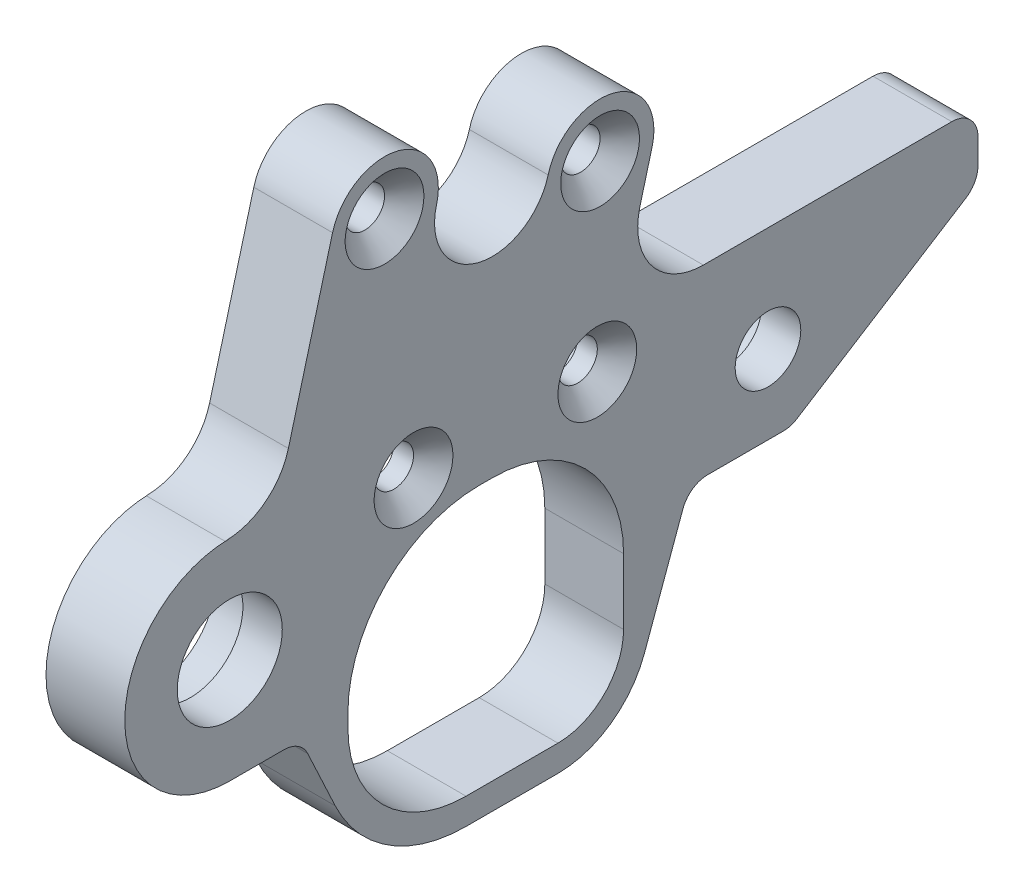
from build123d import *

# Parameters (mm, degrees)
SKETCH27_R          = 4
SKETCH27_R_2        = 2.5
SKETCH27_R_3        = 1.5
BOSS_EXTRUDE1_DEPTH = 6
SKETCH47_R          = 4.99
CUT_EXTRUDE8_DEPTH  = 3
SKETCH49_W          = 20
SKETCH49_H          = 6
CUT_EXTRUDE11_DEPTH = 3
CUT_EXTRUDE13_REACH = 97.747
SKETCH51_R          = 1.5
FILLET3_R           = 2
CHAMFER1_SIZE       = 1.5
FILLET5_START       = -1
FILLET5_DEPTH       = 4
SKETCH52_R          = 3
CUT_EXTRUDE14_DEPTH = 3
SKETCH53_R          = 1.5
CUT_EXTRUDE15_DEPTH = 3


with BuildPart() as part:
    # Sketch27 → Boss-Extrude1 (new body)
    with BuildSketch(Plane(origin=(0, 0, 0), x_dir=(0, 0, -1), z_dir=(1, 0, 0))):
        with BuildLine():
            Line((9, 50), (8.635545685, 50))
            ThreePointArc((8.635545685, 50), (11.67935283, 51.033233299), (13.465174817, 53.705904774))
            Line((13.465174817, 53.705904774), (16.829334589, 66.261119968))
            ThreePointArc((16.829334589, 66.261119968), (21.850788561, 69.160257771), (24.749926364, 64.138803798))
            ThreePointArc((24.749926364, 64.138803798), (27.861196202, 58.749926364), (33.250073636, 61.861196202))
            ThreePointArc((33.250073636, 61.861196202), (38.271527608, 64.760334004), (41.170665411, 59.738880032))
            Line((41.170665411, 59.738880032), (40.247638104, 56.294095226))
            ThreePointArc((40.247638104, 56.294095226), (41.110500534, 51.956192855), (45.077267236, 50))
            Line((45.077267236, 50), (66, 50))
            Line((66, 50), (66, 45))
            Line((66, 45), (51.734508099, 36))
            Line((51.734508099, 36), (43.997036047, 36))
            Line((43.997036047, 36), (40.577848346, 26.605858997))
            ThreePointArc((40.577848346, 26.605858997), (38.015035054, 23.26593569), (34, 22))
            Line((34, 22), (27, 22))
            ThreePointArc((27, 22), (21.089704308, 23.722694096), (17.030614343, 28.351199121))
            Line((17.030614343, 28.351199121), (14.396535233, 34))
            Line((14.396535233, 34), (9, 34))
            ThreePointArc((9, 34), (1, 42), (9, 50))
        make_face()
        with Locations((9, 42)):
            Circle(SKETCH27_R, mode=Mode.SUBTRACT)
        with Locations((50, 42)):
            Circle(SKETCH27_R_2, mode=Mode.SUBTRACT)
        with Locations((37.210369523, 60.800038117)):
            Circle(SKETCH27_R_3, mode=Mode.SUBTRACT)
        with Locations((20.789630477, 65.199961883)):
            Circle(SKETCH27_R_3, mode=Mode.SUBTRACT)
        with BuildLine():
            Line((29, 44), (28, 44))
            ThreePointArc((28, 44), (20.928932188, 41.071067812), (18, 34))
            Line((18, 34), (18, 33))
            ThreePointArc((18, 33), (20.636038969, 26.636038969), (27, 24))
            Line((27, 24), (34, 24))
            ThreePointArc((34, 24), (37.535533906, 25.464466094), (39, 29))
            Line((39, 29), (39, 34))
            ThreePointArc((39, 34), (36.071067812, 41.071067812), (29, 44))
        make_face(mode=Mode.SUBTRACT)
    extrude(amount=BOSS_EXTRUDE1_DEPTH)

    # Sketch47 → Cut-Extrude8 (cut)
    with BuildSketch(Plane.ZY):
        with Locations((-9, 42)):
            Circle(SKETCH47_R)
    extrude(amount=-CUT_EXTRUDE8_DEPTH, mode=Mode.SUBTRACT)

    # Sketch49 → Cut-Extrude11 (cut)
    with BuildSketch(Plane.ZY):
        with Locations((-30, 47)):
            Rectangle(SKETCH49_W, SKETCH49_H)
    extrude(amount=-CUT_EXTRUDE11_DEPTH, mode=Mode.SUBTRACT)

    # Sketch51 → Cut-Extrude13 (cut, up to next)
    with BuildSketch(Plane.ZY.offset(-3), mode=Mode.PRIVATE) as cut_extrude13_sk1:
        with Locations((-37, 47)):
            Circle(SKETCH51_R)
    cut_extrude13_tool1 = extrude(cut_extrude13_sk1.sketch, amount=-CUT_EXTRUDE13_REACH, mode=Mode.PRIVATE) & part.part
    # Sketch51 → Cut-Extrude13 (cut, up to next)
    with BuildSketch(Plane.ZY.offset(-3), mode=Mode.PRIVATE) as cut_extrude13_sk2:
        with Locations((-23, 47)):
            Circle(SKETCH51_R)
    cut_extrude13_tool2 = extrude(cut_extrude13_sk2.sketch, amount=-CUT_EXTRUDE13_REACH, mode=Mode.PRIVATE) & part.part
    add(cut_extrude13_tool1.solids().sort_by_distance((3, 47, -37))[0], mode=Mode.SUBTRACT)
    add(cut_extrude13_tool2.solids().sort_by_distance((3, 47, -23))[0], mode=Mode.SUBTRACT)

    # Fillet3
    fillet3_edges = [part.edges().sort_by_distance(p)[0] for p in [
        (3, 50, -66),
        (3, 45, -66),
        (3, 36, -51.734508099),
        (3, 36, -43.997036047),
        (3, 34, -14.396535233),
    ]]
    fillet(fillet3_edges, radius=FILLET3_R)

    # Chamfer1
    chamfer1_edges = [part.edges().sort_by_distance(p)[0] for p in [
        (6, 47, -38.5),
        (6, 47, -24.5),
        (6, 60.800038117, -35.710369523),
        (6, 65.199961883, -19.289630477),
    ]]
    chamfer(chamfer1_edges, length=CHAMFER1_SIZE)

    # Fillet5: read off the stored shape, not the designer's step
    # Fillet5 outline → Fillet5 (cut)
    with BuildSketch(Plane.YZ.offset(FILLET5_START)):
        with BuildLine():
            Line((44, -28), (44, -23.527864045))
            ThreePointArc((44, -23.527864045), (43.609108945, -24.015814081), (43.047619048, -23.7408229))
            ThreePointArc((43.047619048, -23.7408229), (43.75900073, -25.817821098), (44, -28))
        make_face()
        with BuildLine():
            ThreePointArc((44, -29), (43.75900073, -31.182178902), (43.047619048, -33.2591771))
            ThreePointArc((43.047619048, -33.2591771), (43.609108945, -32.984185919), (44, -33.472135955))
            Line((44, -33.472135955), (44, -29))
        make_face()
    extrude(amount=FILLET5_DEPTH, mode=Mode.SUBTRACT)

    # Sketch52 → Cut-Extrude14 (cut)
    with BuildSketch(Plane.ZY):
        with Locations((-50, 42)):
            Circle(SKETCH52_R)
    extrude(amount=-CUT_EXTRUDE14_DEPTH, mode=Mode.SUBTRACT)

    # Sketch53 → Cut-Extrude15 (cut)
    with BuildSketch(Plane.ZY):
        with Locations((-39, 49)):
            Circle(SKETCH53_R)
        with Locations((-21, 49)):
            Circle(SKETCH53_R)
        with Locations((-21, 45)):
            Circle(SKETCH53_R)
        with Locations((-39, 45)):
            Circle(SKETCH53_R)
    extrude(amount=-CUT_EXTRUDE15_DEPTH, mode=Mode.SUBTRACT)


solid = part.part
